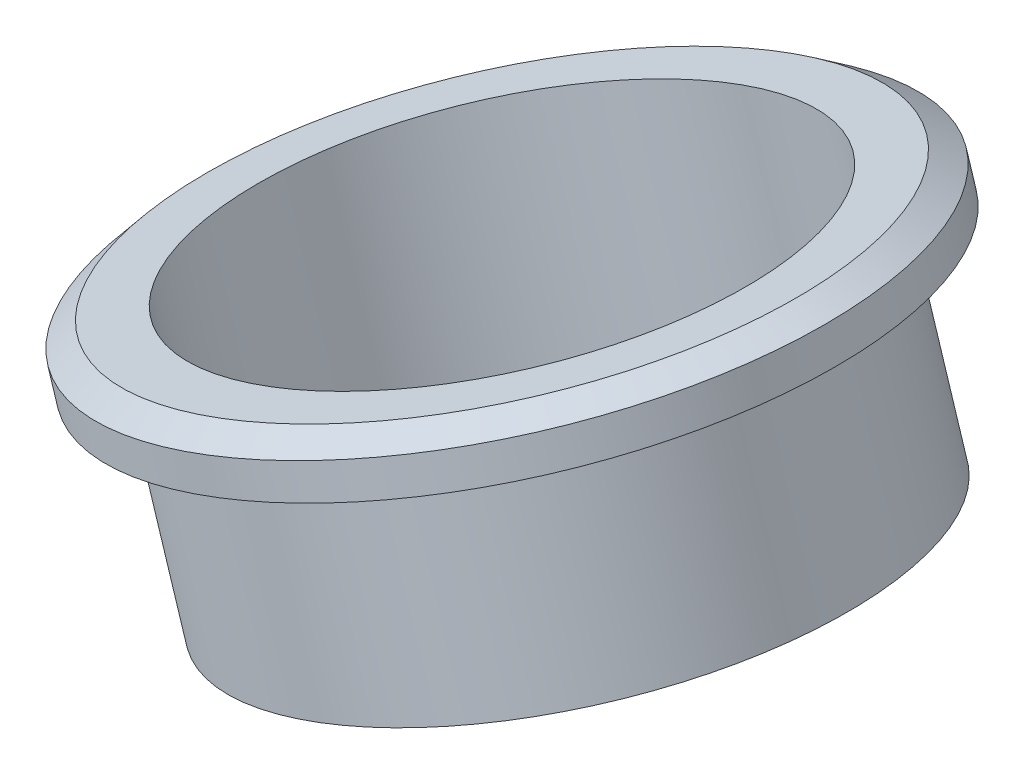
from build123d import *


with BuildPart() as part:
    # Sk_Cono → Cono (revolve)
    with BuildSketch(Plane.XY):
        Polygon((385.500399814, 520.056357213), (387.121714083, 520.567571493), (383.513142692, 532.012142805), (386.37428552, 532.914285653), (385.772856954, 534.821714205), (384.041571258, 535.324357057), (380.989685575, 534.362071352), align=None)
    revolve(axis=Axis((364.894285739, 534.529714208, 0), (0.3007142826457708, -0.9537142759825081, 0)))


solid = part.part
